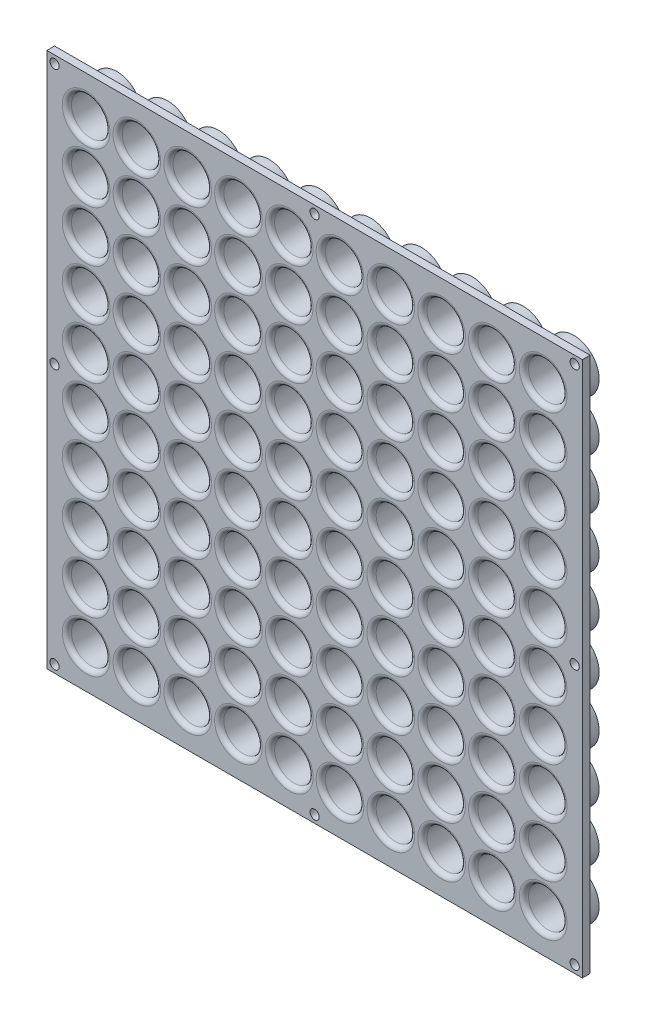
from build123d import *

# Parameters (mm, degrees)
SKETCH1_W                       = 250
SKETCH1_H                       = 250
BOSS_EXTRUDE1_DEPTH             = 50
SKETCH2_W                       = 40
SKETCH2_H                       = 100
SKETCH2_H_2                     = 50
CUT_EXTRUDE1_DEPTH              = 45
FILLET1_R                       = 5
FILLET2_R                       = 5
SKETCH5_R                       = 6.25
CUT_EXTRUDE2_DEPTH              = 22
FILLET5_R                       = 1.5
LPATTERN4_COUNT                 = 10
LPATTERN4_PITCH                 = 16.5
LPATTERN4_COUNT_DIR2            = 10
LPATTERN4_PITCH_DIR2            = 16.5
FILLET5_OF_LPATTERN4_R          = 1.5
CUT_EXTRUDE4_DEPTH              = 45
SKETCH8_W                       = 100
SKETCH8_H                       = 20
CUT_EXTRUDE5_DEPTH              = 30
FILLET6_R                       = 2.5
FILLET7_R                       = 2
SKETCH10_R                      = 13.5
CUT_EXTRUDE6_DEPTH              = 358.071421427
SKETCH4_W                       = 25
SKETCH4_H                       = 17.5
CUT_EXTRUDE7_DEPTH              = 10
VERRUNDUNG1_R                   = 2.5
SKIZZE2_W                       = 25
SKIZZE2_H                       = 5
AUFSATZ_LINEAR_AUSTRAGEN1_DEPTH = 12.5
AUFSATZ_LINEAR_AUSTRAGEN2_DEPTH = 10
SCHNITT_LINEAR_START            = -10
SCHNITT_LINEAR_AUSTRAGEN3_DEPTH = 230
SCHNITT_LINEAR_AUSTRAGEN4_DEPTH = 25
SCHNITT_LINEAR_AUSTRAGEN5_DEPTH = 10
SKIZZE11_W                      = 250
SKIZZE11_H                      = 250
SKIZZE11_W_2                    = 174
SKIZZE11_H_2                    = 174
SCHNITT_LINEAR_AUSTRAGEN6_DEPTH = 358.071421441
SKIZZE12_R                      = 8.2
SKIZZE12_R_2                    = 6.25
AUFSATZ_LINEAR_AUSTRAGEN3_DEPTH = 5
SKIZZE14_R                      = 1.5
SCHNITT_LINEAR_AUSTRAGEN7_DEPTH = 5
SKIZZE15_W                      = 174
SKIZZE15_H                      = 174
SKIZZE15_W_2                    = 164.9
SKIZZE15_H_2                    = 164.9
SCHNITT_LINEAR_AUSTRAGEN8_DEPTH = 2.5
VERRUNDUNG3_R                   = 2.5


with BuildPart() as part:
    # Sketch1 → Boss-Extrude1 (new body)
    with BuildSketch(Plane.XY):
        with Locations((-125, 125)):
            Rectangle(SKETCH1_W, SKETCH1_H)
    extrude(amount=BOSS_EXTRUDE1_DEPTH)

    # Sketch2 → Cut-Extrude1 (cut)
    with BuildSketch(Plane.XY.offset(50)):
        with Locations((-35, 170)):
            Rectangle(SKETCH2_W, SKETCH2_H)
        with Locations((-35, 70)):
            Rectangle(SKETCH2_W, SKETCH2_H_2)
    extrude(amount=-CUT_EXTRUDE1_DEPTH, mode=Mode.SUBTRACT)

    # Fillet1
    fillet1_edges = [part.edges().sort_by_distance(p)[0] for p in [
        (-55, 170, 50),
        (-35, 120, 50),
        (-15, 170, 50),
        (-35, 220, 50),
    ]]
    fillet(fillet1_edges, radius=FILLET1_R)

    # Fillet2
    fillet2_edges = [part.edges().sort_by_distance(p)[0] for p in [
        (-55, 70, 50),
        (-35, 45, 50),
        (-15, 70, 50),
        (-35, 95, 50),
    ]]
    fillet(fillet2_edges, radius=FILLET2_R)

    # Sketch5 → Cut-Extrude2 (cut)
    with BuildSketch(Plane.XY.offset(50)):
        with Locations((-225, 190)):
            Circle(SKETCH5_R)
    cut_extrude2 = extrude(amount=-CUT_EXTRUDE2_DEPTH, mode=Mode.SUBTRACT)

    # Fillet5
    fillet5_edges = [part.edges().sort_by_distance(p)[0] for p in [
        (-231.25, 190, 50),
    ]]
    fillet(fillet5_edges, radius=FILLET5_R)

    # LPattern4: Cut-Extrude2 10 × 10
    with Locations(*[(i * LPATTERN4_PITCH, -j * LPATTERN4_PITCH_DIR2, 0) for i in range(LPATTERN4_COUNT) for j in range(LPATTERN4_COUNT_DIR2) if (i, j) != (0, 0)]):
        add(cut_extrude2, mode=Mode.SUBTRACT)

    # Fillet5 of LPattern4
    fillet5_of_lpattern4_edges = [part.edges().sort_by_distance(p)[0] for p in [
        (-231.25, 173.5, 50),
        (-231.25, 157, 50),
        (-231.25, 140.5, 50),
        (-231.25, 124, 50),
        (-231.25, 107.5, 50),
        (-231.25, 91, 50),
        (-231.25, 74.5, 50),
        (-231.25, 58, 50),
        (-231.25, 41.5, 50),
        (-214.75, 190, 50),
        (-214.75, 173.5, 50),
        (-214.75, 157, 50),
        (-214.75, 140.5, 50),
        (-214.75, 124, 50),
        (-214.75, 107.5, 50),
        (-214.75, 91, 50),
        (-214.75, 74.5, 50),
        (-214.75, 58, 50),
        (-214.75, 41.5, 50),
        (-198.25, 190, 50),
        (-198.25, 173.5, 50),
        (-198.25, 157, 50),
        (-198.25, 140.5, 50),
        (-198.25, 124, 50),
        (-198.25, 107.5, 50),
        (-198.25, 91, 50),
        (-198.25, 74.5, 50),
        (-198.25, 58, 50),
        (-198.25, 41.5, 50),
        (-181.75, 190, 50),
        (-181.75, 173.5, 50),
        (-181.75, 157, 50),
        (-181.75, 140.5, 50),
        (-181.75, 124, 50),
        (-181.75, 107.5, 50),
        (-181.75, 91, 50),
        (-181.75, 74.5, 50),
        (-181.75, 58, 50),
        (-181.75, 41.5, 50),
        (-165.25, 190, 50),
        (-165.25, 173.5, 50),
        (-165.25, 157, 50),
        (-165.25, 140.5, 50),
        (-165.25, 124, 50),
        (-165.25, 107.5, 50),
        (-165.25, 91, 50),
        (-165.25, 74.5, 50),
        (-165.25, 58, 50),
        (-165.25, 41.5, 50),
        (-148.75, 190, 50),
        (-148.75, 173.5, 50),
        (-148.75, 157, 50),
        (-148.75, 140.5, 50),
        (-148.75, 124, 50),
        (-148.75, 107.5, 50),
        (-148.75, 91, 50),
        (-148.75, 74.5, 50),
        (-148.75, 58, 50),
        (-148.75, 41.5, 50),
        (-132.25, 190, 50),
        (-132.25, 173.5, 50),
        (-132.25, 157, 50),
        (-132.25, 140.5, 50),
        (-132.25, 124, 50),
        (-132.25, 107.5, 50),
        (-132.25, 91, 50),
        (-132.25, 74.5, 50),
        (-132.25, 58, 50),
        (-132.25, 41.5, 50),
        (-115.75, 190, 50),
        (-115.75, 173.5, 50),
        (-115.75, 157, 50),
        (-115.75, 140.5, 50),
        (-115.75, 124, 50),
        (-115.75, 107.5, 50),
        (-115.75, 91, 50),
        (-115.75, 74.5, 50),
        (-115.75, 58, 50),
        (-115.75, 41.5, 50),
        (-99.25, 190, 50),
        (-99.25, 173.5, 50),
        (-99.25, 157, 50),
        (-99.25, 140.5, 50),
        (-99.25, 124, 50),
        (-99.25, 107.5, 50),
        (-99.25, 91, 50),
        (-99.25, 74.5, 50),
        (-99.25, 58, 50),
        (-99.25, 41.5, 50),
        (-82.75, 190, 50),
        (-82.75, 173.5, 50),
        (-82.75, 157, 50),
        (-82.75, 140.5, 50),
        (-82.75, 124, 50),
        (-82.75, 107.5, 50),
        (-82.75, 91, 50),
        (-82.75, 74.5, 50),
        (-82.75, 58, 50),
        (-82.75, 41.5, 50),
    ]]
    fillet(fillet5_of_lpattern4_edges, radius=FILLET5_OF_LPATTERN4_R)

    # Sketch7 → Cut-Extrude4 (cut)
    with BuildSketch(Plane(origin=(0, 0, 0), x_dir=(-1, 0, 0), z_dir=(0, 0, -1))):
        Polygon((5, 245), (245, 245), (245, 5), (5, 5), (5, 40), (60, 40), (60, 100), (5, 100), (5, 115), (60, 115), (60, 225), (5, 225), align=None)
    extrude(amount=-CUT_EXTRUDE4_DEPTH, mode=Mode.SUBTRACT)

    # Sketch8 → Cut-Extrude5 (cut)
    with BuildSketch(Plane.XY.offset(50)):
        with Locations((-125, 240)):
            Rectangle(SKETCH8_W, SKETCH8_H)
    extrude(amount=-CUT_EXTRUDE5_DEPTH, mode=Mode.SUBTRACT)

    # Fillet6
    fillet6_edges = [part.edges().sort_by_distance(p)[0] for p in [
        (-125, 230, 45),
        (-125, 230, 50),
    ]]
    fillet(fillet6_edges, radius=FILLET6_R - 0.0001)  # a hair under: the kernel refuses the full size

    # Fillet7
    fillet7_edges = [part.edges().sort_by_distance(p)[0] for p in [
        (-125, 245, 20),
        (-125, 250, 20),
    ]]
    fillet(fillet7_edges, radius=FILLET7_R)

    # Sketch10 → Cut-Extrude6 (cut, through all)
    with BuildSketch(Plane.XY.offset(50)):
        with Locations((-35, 20)):
            Circle(SKETCH10_R)
    extrude(amount=-CUT_EXTRUDE6_DEPTH, mode=Mode.SUBTRACT)

    # Sketch4 → Cut-Extrude7 (cut)
    with BuildSketch(Plane.XY.offset(50)):
        with Locations((-187.5, 241.25)):
            Rectangle(SKETCH4_W, SKETCH4_H)
        with Locations((-62.5, 241.25)):
            Rectangle(SKETCH4_W, SKETCH4_H)
    extrude(amount=-CUT_EXTRUDE7_DEPTH, mode=Mode.SUBTRACT)

    # Verrundung1
    verrundung1_edges = [part.edges().sort_by_distance(p)[0] for p in [
        (-48.5, 20, 45),
        (-48.5, 20, 50),
    ]]
    fillet(verrundung1_edges, radius=VERRUNDUNG1_R - 0.0001)  # a hair under: the kernel refuses the full size

    # Skizze2 → Aufsatz-Linear austragen1 (add)
    with BuildSketch(Plane.XZ.offset(-245)):
        with Locations((-187.5, 37.5)):
            Rectangle(SKIZZE2_W, SKIZZE2_H)
        with Locations((-62.5, 37.5)):
            Rectangle(SKIZZE2_W, SKIZZE2_H)
    extrude(amount=AUFSATZ_LINEAR_AUSTRAGEN1_DEPTH)

    # Skizze4 → Aufsatz-Linear austragen2 (add)
    with BuildSketch(Plane(origin=(0, 0, 45), x_dir=(-1, 0, 0), z_dir=(0, 0, -1))):
        Polygon((50, 232.5), (75, 232.5), (75, 227.5), (49, 227.5), (49, 245), (50, 245), align=None)
        Polygon((200, 232.5), (175, 232.5), (175, 227.5), (201, 227.5), (201, 245), (200, 245), align=None)
    extrude(amount=AUFSATZ_LINEAR_AUSTRAGEN2_DEPTH)

    # Skizze8 → Schnitt-Linear austragen3 (cut)
    with BuildSketch(Plane.XZ.offset(SCHNITT_LINEAR_START)):
        Polygon((-245, 7), (-248, 7), (-248, 4.7), (-246, 4.7), (-245, 4.4), align=None)
    extrude(amount=-SCHNITT_LINEAR_AUSTRAGEN3_DEPTH, mode=Mode.SUBTRACT)

    # Skizze9 → Schnitt-Linear austragen4 (cut)
    with BuildSketch(Plane.XZ.offset(SCHNITT_LINEAR_START)):
        Polygon((-3.733974596, 5), (-4.6, 6.5), (-6.332050808, 6.5), (-7.198076211, 5), (-6.332050808, 3.5), (-4.6, 3.5), align=None)
    extrude(amount=-SCHNITT_LINEAR_AUSTRAGEN4_DEPTH, mode=Mode.SUBTRACT)

    # Skizze10 → Schnitt-Linear austragen5 (cut)
    with BuildSketch(Plane(origin=(0, 250, 0), x_dir=(1, 0, 0), z_dir=(0, 1, 0)).offset(SCHNITT_LINEAR_START)):
        Polygon((-4.6, -3.5), (-6.332050808, -3.5), (-7.198076211, -5), (-6.332050808, -6.5), (-4.6, -6.5), (-3.733974596, -5), align=None)
    extrude(amount=-SCHNITT_LINEAR_AUSTRAGEN5_DEPTH, mode=Mode.SUBTRACT)

    # Skizze11 → Schnitt-Linear austragen6 (cut, through all)
    with BuildSketch(Plane.XY.offset(50)):
        with Locations((-125, 125)):
            Rectangle(SKIZZE11_W, SKIZZE11_H)
        with Locations((-150.75, 115.75)):
            Rectangle(SKIZZE11_W_2, SKIZZE11_H_2, mode=Mode.SUBTRACT)
    extrude(amount=-SCHNITT_LINEAR_AUSTRAGEN6_DEPTH, mode=Mode.SUBTRACT)

    # Skizze12 → Aufsatz-Linear austragen3 (add)
    # profile 1 of 100: a face of its own
    with BuildSketch(Plane(origin=(0, 0, 45), x_dir=(-1, 0, 0), z_dir=(0, 0, -1))):
        with Locations((76.5, 190)):
            Circle(SKIZZE12_R)
        with Locations(Location((76.5, 190, 0), (0, 0, 180))):
            Circle(SKIZZE12_R_2, mode=Mode.SUBTRACT)
    # profile 2 of 100: a face of its own
    with BuildSketch(Plane(origin=(0, 0, 45), x_dir=(-1, 0, 0), z_dir=(0, 0, -1))):
        with Locations((93, 190)):
            Circle(SKIZZE12_R)
        with Locations(Location((93, 190, 0), (0, 0, 180))):
            Circle(SKIZZE12_R_2, mode=Mode.SUBTRACT)
    # profile 3 of 100: a face of its own
    with BuildSketch(Plane(origin=(0, 0, 45), x_dir=(-1, 0, 0), z_dir=(0, 0, -1))):
        with Locations((109.5, 190)):
            Circle(SKIZZE12_R)
        with Locations(Location((109.5, 190, 0), (0, 0, 180))):
            Circle(SKIZZE12_R_2, mode=Mode.SUBTRACT)
    # profile 4 of 100: a face of its own
    with BuildSketch(Plane(origin=(0, 0, 45), x_dir=(-1, 0, 0), z_dir=(0, 0, -1))):
        with Locations((126, 190)):
            Circle(SKIZZE12_R)
        with Locations(Location((126, 190, 0), (0, 0, 180))):
            Circle(SKIZZE12_R_2, mode=Mode.SUBTRACT)
    # profile 5 of 100: a face of its own
    with BuildSketch(Plane(origin=(0, 0, 45), x_dir=(-1, 0, 0), z_dir=(0, 0, -1))):
        with Locations((142.5, 190)):
            Circle(SKIZZE12_R)
        with Locations(Location((142.5, 190, 0), (0, 0, 180))):
            Circle(SKIZZE12_R_2, mode=Mode.SUBTRACT)
    # profile 6 of 100: a face of its own
    with BuildSketch(Plane(origin=(0, 0, 45), x_dir=(-1, 0, 0), z_dir=(0, 0, -1))):
        with Locations((159, 190)):
            Circle(SKIZZE12_R)
        with Locations(Location((159, 190, 0), (0, 0, 180))):
            Circle(SKIZZE12_R_2, mode=Mode.SUBTRACT)
    # profile 7 of 100: a face of its own
    with BuildSketch(Plane(origin=(0, 0, 45), x_dir=(-1, 0, 0), z_dir=(0, 0, -1))):
        with Locations((175.5, 190)):
            Circle(SKIZZE12_R)
        with Locations(Location((175.5, 190, 0), (0, 0, 180))):
            Circle(SKIZZE12_R_2, mode=Mode.SUBTRACT)
    # profile 8 of 100: a face of its own
    with BuildSketch(Plane(origin=(0, 0, 45), x_dir=(-1, 0, 0), z_dir=(0, 0, -1))):
        with Locations((192, 190)):
            Circle(SKIZZE12_R)
        with Locations(Location((192, 190, 0), (0, 0, 180))):
            Circle(SKIZZE12_R_2, mode=Mode.SUBTRACT)
    # profile 9 of 100: a face of its own
    with BuildSketch(Plane(origin=(0, 0, 45), x_dir=(-1, 0, 0), z_dir=(0, 0, -1))):
        with Locations((208.5, 190)):
            Circle(SKIZZE12_R)
        with Locations(Location((208.5, 190, 0), (0, 0, 180))):
            Circle(SKIZZE12_R_2, mode=Mode.SUBTRACT)
    # profile 10 of 100: a face of its own
    with BuildSketch(Plane(origin=(0, 0, 45), x_dir=(-1, 0, 0), z_dir=(0, 0, -1))):
        with Locations((225, 190)):
            Circle(SKIZZE12_R)
        with Locations(Location((225, 190, 0), (0, 0, 180))):
            Circle(SKIZZE12_R_2, mode=Mode.SUBTRACT)
    # profile 11 of 100: a face of its own
    with BuildSketch(Plane(origin=(0, 0, 45), x_dir=(-1, 0, 0), z_dir=(0, 0, -1))):
        with Locations((93, 173.5)):
            Circle(SKIZZE12_R)
        with Locations(Location((93, 173.5, 0), (0, 0, 180))):
            Circle(SKIZZE12_R_2, mode=Mode.SUBTRACT)
    # profile 12 of 100: a face of its own
    with BuildSketch(Plane(origin=(0, 0, 45), x_dir=(-1, 0, 0), z_dir=(0, 0, -1))):
        with Locations((109.5, 173.5)):
            Circle(SKIZZE12_R)
        with Locations(Location((109.5, 173.5, 0), (0, 0, 180))):
            Circle(SKIZZE12_R_2, mode=Mode.SUBTRACT)
    # profile 13 of 100: a face of its own
    with BuildSketch(Plane(origin=(0, 0, 45), x_dir=(-1, 0, 0), z_dir=(0, 0, -1))):
        with Locations((126, 173.5)):
            Circle(SKIZZE12_R)
        with Locations(Location((126, 173.5, 0), (0, 0, 180))):
            Circle(SKIZZE12_R_2, mode=Mode.SUBTRACT)
    # profile 14 of 100: a face of its own
    with BuildSketch(Plane(origin=(0, 0, 45), x_dir=(-1, 0, 0), z_dir=(0, 0, -1))):
        with Locations((142.5, 173.5)):
            Circle(SKIZZE12_R)
        with Locations(Location((142.5, 173.5, 0), (0, 0, 180))):
            Circle(SKIZZE12_R_2, mode=Mode.SUBTRACT)
    # profile 15 of 100: a face of its own
    with BuildSketch(Plane(origin=(0, 0, 45), x_dir=(-1, 0, 0), z_dir=(0, 0, -1))):
        with Locations((159, 173.5)):
            Circle(SKIZZE12_R)
        with Locations(Location((159, 173.5, 0), (0, 0, 180))):
            Circle(SKIZZE12_R_2, mode=Mode.SUBTRACT)
    # profile 16 of 100: a face of its own
    with BuildSketch(Plane(origin=(0, 0, 45), x_dir=(-1, 0, 0), z_dir=(0, 0, -1))):
        with Locations((175.5, 173.5)):
            Circle(SKIZZE12_R)
        with Locations(Location((175.5, 173.5, 0), (0, 0, 180))):
            Circle(SKIZZE12_R_2, mode=Mode.SUBTRACT)
    # profile 17 of 100: a face of its own
    with BuildSketch(Plane(origin=(0, 0, 45), x_dir=(-1, 0, 0), z_dir=(0, 0, -1))):
        with Locations((192, 173.5)):
            Circle(SKIZZE12_R)
        with Locations(Location((192, 173.5, 0), (0, 0, 180))):
            Circle(SKIZZE12_R_2, mode=Mode.SUBTRACT)
    # profile 18 of 100: a face of its own
    with BuildSketch(Plane(origin=(0, 0, 45), x_dir=(-1, 0, 0), z_dir=(0, 0, -1))):
        with Locations((208.5, 173.5)):
            Circle(SKIZZE12_R)
        with Locations(Location((208.5, 173.5, 0), (0, 0, 180))):
            Circle(SKIZZE12_R_2, mode=Mode.SUBTRACT)
    # profile 19 of 100: a face of its own
    with BuildSketch(Plane(origin=(0, 0, 45), x_dir=(-1, 0, 0), z_dir=(0, 0, -1))):
        with Locations((225, 173.5)):
            Circle(SKIZZE12_R)
        with Locations(Location((225, 173.5, 0), (0, 0, 180))):
            Circle(SKIZZE12_R_2, mode=Mode.SUBTRACT)
    # profile 20 of 100: a face of its own
    with BuildSketch(Plane(origin=(0, 0, 45), x_dir=(-1, 0, 0), z_dir=(0, 0, -1))):
        with Locations((93, 157)):
            Circle(SKIZZE12_R)
        with Locations(Location((93, 157, 0), (0, 0, 180))):
            Circle(SKIZZE12_R_2, mode=Mode.SUBTRACT)
    # profile 21 of 100: a face of its own
    with BuildSketch(Plane(origin=(0, 0, 45), x_dir=(-1, 0, 0), z_dir=(0, 0, -1))):
        with Locations((109.5, 157)):
            Circle(SKIZZE12_R)
        with Locations(Location((109.5, 157, 0), (0, 0, 180))):
            Circle(SKIZZE12_R_2, mode=Mode.SUBTRACT)
    # profile 22 of 100: a face of its own
    with BuildSketch(Plane(origin=(0, 0, 45), x_dir=(-1, 0, 0), z_dir=(0, 0, -1))):
        with Locations((126, 157)):
            Circle(SKIZZE12_R)
        with Locations(Location((126, 157, 0), (0, 0, 180))):
            Circle(SKIZZE12_R_2, mode=Mode.SUBTRACT)
    # profile 23 of 100: a face of its own
    with BuildSketch(Plane(origin=(0, 0, 45), x_dir=(-1, 0, 0), z_dir=(0, 0, -1))):
        with Locations((142.5, 157)):
            Circle(SKIZZE12_R)
        with Locations(Location((142.5, 157, 0), (0, 0, 180))):
            Circle(SKIZZE12_R_2, mode=Mode.SUBTRACT)
    # profile 24 of 100: a face of its own
    with BuildSketch(Plane(origin=(0, 0, 45), x_dir=(-1, 0, 0), z_dir=(0, 0, -1))):
        with Locations((159, 157)):
            Circle(SKIZZE12_R)
        with Locations(Location((159, 157, 0), (0, 0, 180))):
            Circle(SKIZZE12_R_2, mode=Mode.SUBTRACT)
    # profile 25 of 100: a face of its own
    with BuildSketch(Plane(origin=(0, 0, 45), x_dir=(-1, 0, 0), z_dir=(0, 0, -1))):
        with Locations((175.5, 157)):
            Circle(SKIZZE12_R)
        with Locations(Location((175.5, 157, 0), (0, 0, 180))):
            Circle(SKIZZE12_R_2, mode=Mode.SUBTRACT)
    # profile 26 of 100: a face of its own
    with BuildSketch(Plane(origin=(0, 0, 45), x_dir=(-1, 0, 0), z_dir=(0, 0, -1))):
        with Locations((192, 157)):
            Circle(SKIZZE12_R)
        with Locations(Location((192, 157, 0), (0, 0, 180))):
            Circle(SKIZZE12_R_2, mode=Mode.SUBTRACT)
    # profile 27 of 100: a face of its own
    with BuildSketch(Plane(origin=(0, 0, 45), x_dir=(-1, 0, 0), z_dir=(0, 0, -1))):
        with Locations((208.5, 157)):
            Circle(SKIZZE12_R)
        with Locations(Location((208.5, 157, 0), (0, 0, 180))):
            Circle(SKIZZE12_R_2, mode=Mode.SUBTRACT)
    # profile 28 of 100: a face of its own
    with BuildSketch(Plane(origin=(0, 0, 45), x_dir=(-1, 0, 0), z_dir=(0, 0, -1))):
        with Locations((225, 157)):
            Circle(SKIZZE12_R)
        with Locations(Location((225, 157, 0), (0, 0, 180))):
            Circle(SKIZZE12_R_2, mode=Mode.SUBTRACT)
    # profile 29 of 100: a face of its own
    with BuildSketch(Plane(origin=(0, 0, 45), x_dir=(-1, 0, 0), z_dir=(0, 0, -1))):
        with Locations((93, 140.5)):
            Circle(SKIZZE12_R)
        with Locations(Location((93, 140.5, 0), (0, 0, 180))):
            Circle(SKIZZE12_R_2, mode=Mode.SUBTRACT)
    # profile 30 of 100: a face of its own
    with BuildSketch(Plane(origin=(0, 0, 45), x_dir=(-1, 0, 0), z_dir=(0, 0, -1))):
        with Locations((109.5, 140.5)):
            Circle(SKIZZE12_R)
        with Locations(Location((109.5, 140.5, 0), (0, 0, 180))):
            Circle(SKIZZE12_R_2, mode=Mode.SUBTRACT)
    # profile 31 of 100: a face of its own
    with BuildSketch(Plane(origin=(0, 0, 45), x_dir=(-1, 0, 0), z_dir=(0, 0, -1))):
        with Locations((126, 140.5)):
            Circle(SKIZZE12_R)
        with Locations(Location((126, 140.5, 0), (0, 0, 180))):
            Circle(SKIZZE12_R_2, mode=Mode.SUBTRACT)
    # profile 32 of 100: a face of its own
    with BuildSketch(Plane(origin=(0, 0, 45), x_dir=(-1, 0, 0), z_dir=(0, 0, -1))):
        with Locations((142.5, 140.5)):
            Circle(SKIZZE12_R)
        with Locations(Location((142.5, 140.5, 0), (0, 0, 180))):
            Circle(SKIZZE12_R_2, mode=Mode.SUBTRACT)
    # profile 33 of 100: a face of its own
    with BuildSketch(Plane(origin=(0, 0, 45), x_dir=(-1, 0, 0), z_dir=(0, 0, -1))):
        with Locations((159, 140.5)):
            Circle(SKIZZE12_R)
        with Locations(Location((159, 140.5, 0), (0, 0, 180))):
            Circle(SKIZZE12_R_2, mode=Mode.SUBTRACT)
    # profile 34 of 100: a face of its own
    with BuildSketch(Plane(origin=(0, 0, 45), x_dir=(-1, 0, 0), z_dir=(0, 0, -1))):
        with Locations((175.5, 140.5)):
            Circle(SKIZZE12_R)
        with Locations(Location((175.5, 140.5, 0), (0, 0, 180))):
            Circle(SKIZZE12_R_2, mode=Mode.SUBTRACT)
    # profile 35 of 100: a face of its own
    with BuildSketch(Plane(origin=(0, 0, 45), x_dir=(-1, 0, 0), z_dir=(0, 0, -1))):
        with Locations((192, 140.5)):
            Circle(SKIZZE12_R)
        with Locations(Location((192, 140.5, 0), (0, 0, 180))):
            Circle(SKIZZE12_R_2, mode=Mode.SUBTRACT)
    # profile 36 of 100: a face of its own
    with BuildSketch(Plane(origin=(0, 0, 45), x_dir=(-1, 0, 0), z_dir=(0, 0, -1))):
        with Locations((208.5, 140.5)):
            Circle(SKIZZE12_R)
        with Locations(Location((208.5, 140.5, 0), (0, 0, 180))):
            Circle(SKIZZE12_R_2, mode=Mode.SUBTRACT)
    # profile 37 of 100: a face of its own
    with BuildSketch(Plane(origin=(0, 0, 45), x_dir=(-1, 0, 0), z_dir=(0, 0, -1))):
        with Locations((225, 140.5)):
            Circle(SKIZZE12_R)
        with Locations(Location((225, 140.5, 0), (0, 0, 180))):
            Circle(SKIZZE12_R_2, mode=Mode.SUBTRACT)
    # profile 38 of 100: a face of its own
    with BuildSketch(Plane(origin=(0, 0, 45), x_dir=(-1, 0, 0), z_dir=(0, 0, -1))):
        with Locations((93, 124)):
            Circle(SKIZZE12_R)
        with Locations(Location((93, 124, 0), (0, 0, 180))):
            Circle(SKIZZE12_R_2, mode=Mode.SUBTRACT)
    # profile 39 of 100: a face of its own
    with BuildSketch(Plane(origin=(0, 0, 45), x_dir=(-1, 0, 0), z_dir=(0, 0, -1))):
        with Locations((109.5, 124)):
            Circle(SKIZZE12_R)
        with Locations(Location((109.5, 124, 0), (0, 0, 180))):
            Circle(SKIZZE12_R_2, mode=Mode.SUBTRACT)
    # profile 40 of 100: a face of its own
    with BuildSketch(Plane(origin=(0, 0, 45), x_dir=(-1, 0, 0), z_dir=(0, 0, -1))):
        with Locations((126, 124)):
            Circle(SKIZZE12_R)
        with Locations(Location((126, 124, 0), (0, 0, 180))):
            Circle(SKIZZE12_R_2, mode=Mode.SUBTRACT)
    # profile 41 of 100: a face of its own
    with BuildSketch(Plane(origin=(0, 0, 45), x_dir=(-1, 0, 0), z_dir=(0, 0, -1))):
        with Locations((142.5, 124)):
            Circle(SKIZZE12_R)
        with Locations(Location((142.5, 124, 0), (0, 0, 180))):
            Circle(SKIZZE12_R_2, mode=Mode.SUBTRACT)
    # profile 42 of 100: a face of its own
    with BuildSketch(Plane(origin=(0, 0, 45), x_dir=(-1, 0, 0), z_dir=(0, 0, -1))):
        with Locations((159, 124)):
            Circle(SKIZZE12_R)
        with Locations(Location((159, 124, 0), (0, 0, 180))):
            Circle(SKIZZE12_R_2, mode=Mode.SUBTRACT)
    # profile 43 of 100: a face of its own
    with BuildSketch(Plane(origin=(0, 0, 45), x_dir=(-1, 0, 0), z_dir=(0, 0, -1))):
        with Locations((175.5, 124)):
            Circle(SKIZZE12_R)
        with Locations(Location((175.5, 124, 0), (0, 0, 180))):
            Circle(SKIZZE12_R_2, mode=Mode.SUBTRACT)
    # profile 44 of 100: a face of its own
    with BuildSketch(Plane(origin=(0, 0, 45), x_dir=(-1, 0, 0), z_dir=(0, 0, -1))):
        with Locations((192, 124)):
            Circle(SKIZZE12_R)
        with Locations(Location((192, 124, 0), (0, 0, 180))):
            Circle(SKIZZE12_R_2, mode=Mode.SUBTRACT)
    # profile 45 of 100: a face of its own
    with BuildSketch(Plane(origin=(0, 0, 45), x_dir=(-1, 0, 0), z_dir=(0, 0, -1))):
        with Locations((208.5, 124)):
            Circle(SKIZZE12_R)
        with Locations(Location((208.5, 124, 0), (0, 0, 180))):
            Circle(SKIZZE12_R_2, mode=Mode.SUBTRACT)
    # profile 46 of 100: a face of its own
    with BuildSketch(Plane(origin=(0, 0, 45), x_dir=(-1, 0, 0), z_dir=(0, 0, -1))):
        with Locations((225, 124)):
            Circle(SKIZZE12_R)
        with Locations(Location((225, 124, 0), (0, 0, 180))):
            Circle(SKIZZE12_R_2, mode=Mode.SUBTRACT)
    # profile 47 of 100: a face of its own
    with BuildSketch(Plane(origin=(0, 0, 45), x_dir=(-1, 0, 0), z_dir=(0, 0, -1))):
        with Locations((93, 107.5)):
            Circle(SKIZZE12_R)
        with Locations(Location((93, 107.5, 0), (0, 0, 180))):
            Circle(SKIZZE12_R_2, mode=Mode.SUBTRACT)
    # profile 48 of 100: a face of its own
    with BuildSketch(Plane(origin=(0, 0, 45), x_dir=(-1, 0, 0), z_dir=(0, 0, -1))):
        with Locations((109.5, 107.5)):
            Circle(SKIZZE12_R)
        with Locations(Location((109.5, 107.5, 0), (0, 0, 180))):
            Circle(SKIZZE12_R_2, mode=Mode.SUBTRACT)
    # profile 49 of 100: a face of its own
    with BuildSketch(Plane(origin=(0, 0, 45), x_dir=(-1, 0, 0), z_dir=(0, 0, -1))):
        with Locations((126, 107.5)):
            Circle(SKIZZE12_R)
        with Locations(Location((126, 107.5, 0), (0, 0, 180))):
            Circle(SKIZZE12_R_2, mode=Mode.SUBTRACT)
    # profile 50 of 100: a face of its own
    with BuildSketch(Plane(origin=(0, 0, 45), x_dir=(-1, 0, 0), z_dir=(0, 0, -1))):
        with Locations((142.5, 107.5)):
            Circle(SKIZZE12_R)
        with Locations(Location((142.5, 107.5, 0), (0, 0, 180))):
            Circle(SKIZZE12_R_2, mode=Mode.SUBTRACT)
    # profile 51 of 100: a face of its own
    with BuildSketch(Plane(origin=(0, 0, 45), x_dir=(-1, 0, 0), z_dir=(0, 0, -1))):
        with Locations((159, 107.5)):
            Circle(SKIZZE12_R)
        with Locations(Location((159, 107.5, 0), (0, 0, 180))):
            Circle(SKIZZE12_R_2, mode=Mode.SUBTRACT)
    # profile 52 of 100: a face of its own
    with BuildSketch(Plane(origin=(0, 0, 45), x_dir=(-1, 0, 0), z_dir=(0, 0, -1))):
        with Locations((175.5, 107.5)):
            Circle(SKIZZE12_R)
        with Locations(Location((175.5, 107.5, 0), (0, 0, 180))):
            Circle(SKIZZE12_R_2, mode=Mode.SUBTRACT)
    # profile 53 of 100: a face of its own
    with BuildSketch(Plane(origin=(0, 0, 45), x_dir=(-1, 0, 0), z_dir=(0, 0, -1))):
        with Locations((192, 107.5)):
            Circle(SKIZZE12_R)
        with Locations(Location((192, 107.5, 0), (0, 0, 180))):
            Circle(SKIZZE12_R_2, mode=Mode.SUBTRACT)
    # profile 54 of 100: a face of its own
    with BuildSketch(Plane(origin=(0, 0, 45), x_dir=(-1, 0, 0), z_dir=(0, 0, -1))):
        with Locations((208.5, 107.5)):
            Circle(SKIZZE12_R)
        with Locations(Location((208.5, 107.5, 0), (0, 0, 180))):
            Circle(SKIZZE12_R_2, mode=Mode.SUBTRACT)
    # profile 55 of 100: a face of its own
    with BuildSketch(Plane(origin=(0, 0, 45), x_dir=(-1, 0, 0), z_dir=(0, 0, -1))):
        with Locations((225, 107.5)):
            Circle(SKIZZE12_R)
        with Locations(Location((225, 107.5, 0), (0, 0, 180))):
            Circle(SKIZZE12_R_2, mode=Mode.SUBTRACT)
    # profile 56 of 100: a face of its own
    with BuildSketch(Plane(origin=(0, 0, 45), x_dir=(-1, 0, 0), z_dir=(0, 0, -1))):
        with Locations((93, 91)):
            Circle(SKIZZE12_R)
        with Locations(Location((93, 91, 0), (0, 0, 180))):
            Circle(SKIZZE12_R_2, mode=Mode.SUBTRACT)
    # profile 57 of 100: a face of its own
    with BuildSketch(Plane(origin=(0, 0, 45), x_dir=(-1, 0, 0), z_dir=(0, 0, -1))):
        with Locations((109.5, 91)):
            Circle(SKIZZE12_R)
        with Locations(Location((109.5, 91, 0), (0, 0, 180))):
            Circle(SKIZZE12_R_2, mode=Mode.SUBTRACT)
    # profile 58 of 100: a face of its own
    with BuildSketch(Plane(origin=(0, 0, 45), x_dir=(-1, 0, 0), z_dir=(0, 0, -1))):
        with Locations((126, 91)):
            Circle(SKIZZE12_R)
        with Locations(Location((126, 91, 0), (0, 0, 180))):
            Circle(SKIZZE12_R_2, mode=Mode.SUBTRACT)
    # profile 59 of 100: a face of its own
    with BuildSketch(Plane(origin=(0, 0, 45), x_dir=(-1, 0, 0), z_dir=(0, 0, -1))):
        with Locations((142.5, 91)):
            Circle(SKIZZE12_R)
        with Locations(Location((142.5, 91, 0), (0, 0, 180))):
            Circle(SKIZZE12_R_2, mode=Mode.SUBTRACT)
    # profile 60 of 100: a face of its own
    with BuildSketch(Plane(origin=(0, 0, 45), x_dir=(-1, 0, 0), z_dir=(0, 0, -1))):
        with Locations((159, 91)):
            Circle(SKIZZE12_R)
        with Locations(Location((159, 91, 0), (0, 0, 180))):
            Circle(SKIZZE12_R_2, mode=Mode.SUBTRACT)
    # profile 61 of 100: a face of its own
    with BuildSketch(Plane(origin=(0, 0, 45), x_dir=(-1, 0, 0), z_dir=(0, 0, -1))):
        with Locations((175.5, 91)):
            Circle(SKIZZE12_R)
        with Locations(Location((175.5, 91, 0), (0, 0, 180))):
            Circle(SKIZZE12_R_2, mode=Mode.SUBTRACT)
    # profile 62 of 100: a face of its own
    with BuildSketch(Plane(origin=(0, 0, 45), x_dir=(-1, 0, 0), z_dir=(0, 0, -1))):
        with Locations((192, 91)):
            Circle(SKIZZE12_R)
        with Locations(Location((192, 91, 0), (0, 0, 180))):
            Circle(SKIZZE12_R_2, mode=Mode.SUBTRACT)
    # profile 63 of 100: a face of its own
    with BuildSketch(Plane(origin=(0, 0, 45), x_dir=(-1, 0, 0), z_dir=(0, 0, -1))):
        with Locations((208.5, 91)):
            Circle(SKIZZE12_R)
        with Locations(Location((208.5, 91, 0), (0, 0, 180))):
            Circle(SKIZZE12_R_2, mode=Mode.SUBTRACT)
    # profile 64 of 100: a face of its own
    with BuildSketch(Plane(origin=(0, 0, 45), x_dir=(-1, 0, 0), z_dir=(0, 0, -1))):
        with Locations((225, 91)):
            Circle(SKIZZE12_R)
        with Locations(Location((225, 91, 0), (0, 0, 180))):
            Circle(SKIZZE12_R_2, mode=Mode.SUBTRACT)
    # profile 65 of 100: a face of its own
    with BuildSketch(Plane(origin=(0, 0, 45), x_dir=(-1, 0, 0), z_dir=(0, 0, -1))):
        with Locations((93, 74.5)):
            Circle(SKIZZE12_R)
        with Locations(Location((93, 74.5, 0), (0, 0, 180))):
            Circle(SKIZZE12_R_2, mode=Mode.SUBTRACT)
    # profile 66 of 100: a face of its own
    with BuildSketch(Plane(origin=(0, 0, 45), x_dir=(-1, 0, 0), z_dir=(0, 0, -1))):
        with Locations((109.5, 74.5)):
            Circle(SKIZZE12_R)
        with Locations(Location((109.5, 74.5, 0), (0, 0, 180))):
            Circle(SKIZZE12_R_2, mode=Mode.SUBTRACT)
    # profile 67 of 100: a face of its own
    with BuildSketch(Plane(origin=(0, 0, 45), x_dir=(-1, 0, 0), z_dir=(0, 0, -1))):
        with Locations((126, 74.5)):
            Circle(SKIZZE12_R)
        with Locations(Location((126, 74.5, 0), (0, 0, 180))):
            Circle(SKIZZE12_R_2, mode=Mode.SUBTRACT)
    # profile 68 of 100: a face of its own
    with BuildSketch(Plane(origin=(0, 0, 45), x_dir=(-1, 0, 0), z_dir=(0, 0, -1))):
        with Locations((142.5, 74.5)):
            Circle(SKIZZE12_R)
        with Locations(Location((142.5, 74.5, 0), (0, 0, 180))):
            Circle(SKIZZE12_R_2, mode=Mode.SUBTRACT)
    # profile 69 of 100: a face of its own
    with BuildSketch(Plane(origin=(0, 0, 45), x_dir=(-1, 0, 0), z_dir=(0, 0, -1))):
        with Locations((159, 74.5)):
            Circle(SKIZZE12_R)
        with Locations(Location((159, 74.5, 0), (0, 0, 180))):
            Circle(SKIZZE12_R_2, mode=Mode.SUBTRACT)
    # profile 70 of 100: a face of its own
    with BuildSketch(Plane(origin=(0, 0, 45), x_dir=(-1, 0, 0), z_dir=(0, 0, -1))):
        with Locations((175.5, 74.5)):
            Circle(SKIZZE12_R)
        with Locations(Location((175.5, 74.5, 0), (0, 0, 180))):
            Circle(SKIZZE12_R_2, mode=Mode.SUBTRACT)
    # profile 71 of 100: a face of its own
    with BuildSketch(Plane(origin=(0, 0, 45), x_dir=(-1, 0, 0), z_dir=(0, 0, -1))):
        with Locations((192, 74.5)):
            Circle(SKIZZE12_R)
        with Locations(Location((192, 74.5, 0), (0, 0, 180))):
            Circle(SKIZZE12_R_2, mode=Mode.SUBTRACT)
    # profile 72 of 100: a face of its own
    with BuildSketch(Plane(origin=(0, 0, 45), x_dir=(-1, 0, 0), z_dir=(0, 0, -1))):
        with Locations((208.5, 74.5)):
            Circle(SKIZZE12_R)
        with Locations(Location((208.5, 74.5, 0), (0, 0, 180))):
            Circle(SKIZZE12_R_2, mode=Mode.SUBTRACT)
    # profile 73 of 100: a face of its own
    with BuildSketch(Plane(origin=(0, 0, 45), x_dir=(-1, 0, 0), z_dir=(0, 0, -1))):
        with Locations((225, 74.5)):
            Circle(SKIZZE12_R)
        with Locations(Location((225, 74.5, 0), (0, 0, 180))):
            Circle(SKIZZE12_R_2, mode=Mode.SUBTRACT)
    # profile 74 of 100: a face of its own
    with BuildSketch(Plane(origin=(0, 0, 45), x_dir=(-1, 0, 0), z_dir=(0, 0, -1))):
        with Locations((93, 58)):
            Circle(SKIZZE12_R)
        with Locations(Location((93, 58, 0), (0, 0, 180))):
            Circle(SKIZZE12_R_2, mode=Mode.SUBTRACT)
    # profile 75 of 100: a face of its own
    with BuildSketch(Plane(origin=(0, 0, 45), x_dir=(-1, 0, 0), z_dir=(0, 0, -1))):
        with Locations((109.5, 58)):
            Circle(SKIZZE12_R)
        with Locations(Location((109.5, 58, 0), (0, 0, 180))):
            Circle(SKIZZE12_R_2, mode=Mode.SUBTRACT)
    # profile 76 of 100: a face of its own
    with BuildSketch(Plane(origin=(0, 0, 45), x_dir=(-1, 0, 0), z_dir=(0, 0, -1))):
        with Locations((126, 58)):
            Circle(SKIZZE12_R)
        with Locations(Location((126, 58, 0), (0, 0, 180))):
            Circle(SKIZZE12_R_2, mode=Mode.SUBTRACT)
    # profile 77 of 100: a face of its own
    with BuildSketch(Plane(origin=(0, 0, 45), x_dir=(-1, 0, 0), z_dir=(0, 0, -1))):
        with Locations((142.5, 58)):
            Circle(SKIZZE12_R)
        with Locations(Location((142.5, 58, 0), (0, 0, 180))):
            Circle(SKIZZE12_R_2, mode=Mode.SUBTRACT)
    # profile 78 of 100: a face of its own
    with BuildSketch(Plane(origin=(0, 0, 45), x_dir=(-1, 0, 0), z_dir=(0, 0, -1))):
        with Locations((159, 58)):
            Circle(SKIZZE12_R)
        with Locations(Location((159, 58, 0), (0, 0, 180))):
            Circle(SKIZZE12_R_2, mode=Mode.SUBTRACT)
    # profile 79 of 100: a face of its own
    with BuildSketch(Plane(origin=(0, 0, 45), x_dir=(-1, 0, 0), z_dir=(0, 0, -1))):
        with Locations((175.5, 58)):
            Circle(SKIZZE12_R)
        with Locations(Location((175.5, 58, 0), (0, 0, 180))):
            Circle(SKIZZE12_R_2, mode=Mode.SUBTRACT)
    # profile 80 of 100: a face of its own
    with BuildSketch(Plane(origin=(0, 0, 45), x_dir=(-1, 0, 0), z_dir=(0, 0, -1))):
        with Locations((192, 58)):
            Circle(SKIZZE12_R)
        with Locations(Location((192, 58, 0), (0, 0, 180))):
            Circle(SKIZZE12_R_2, mode=Mode.SUBTRACT)
    # profile 81 of 100: a face of its own
    with BuildSketch(Plane(origin=(0, 0, 45), x_dir=(-1, 0, 0), z_dir=(0, 0, -1))):
        with Locations((208.5, 58)):
            Circle(SKIZZE12_R)
        with Locations(Location((208.5, 58, 0), (0, 0, 180))):
            Circle(SKIZZE12_R_2, mode=Mode.SUBTRACT)
    # profile 82 of 100: a face of its own
    with BuildSketch(Plane(origin=(0, 0, 45), x_dir=(-1, 0, 0), z_dir=(0, 0, -1))):
        with Locations((225, 58)):
            Circle(SKIZZE12_R)
        with Locations(Location((225, 58, 0), (0, 0, 180))):
            Circle(SKIZZE12_R_2, mode=Mode.SUBTRACT)
    # profile 83 of 100: a face of its own
    with BuildSketch(Plane(origin=(0, 0, 45), x_dir=(-1, 0, 0), z_dir=(0, 0, -1))):
        with Locations((93, 41.5)):
            Circle(SKIZZE12_R)
        with Locations(Location((93, 41.5, 0), (0, 0, 180))):
            Circle(SKIZZE12_R_2, mode=Mode.SUBTRACT)
    # profile 84 of 100: a face of its own
    with BuildSketch(Plane(origin=(0, 0, 45), x_dir=(-1, 0, 0), z_dir=(0, 0, -1))):
        with Locations((109.5, 41.5)):
            Circle(SKIZZE12_R)
        with Locations(Location((109.5, 41.5, 0), (0, 0, 180))):
            Circle(SKIZZE12_R_2, mode=Mode.SUBTRACT)
    # profile 85 of 100: a face of its own
    with BuildSketch(Plane(origin=(0, 0, 45), x_dir=(-1, 0, 0), z_dir=(0, 0, -1))):
        with Locations((126, 41.5)):
            Circle(SKIZZE12_R)
        with Locations(Location((126, 41.5, 0), (0, 0, 180))):
            Circle(SKIZZE12_R_2, mode=Mode.SUBTRACT)
    # profile 86 of 100: a face of its own
    with BuildSketch(Plane(origin=(0, 0, 45), x_dir=(-1, 0, 0), z_dir=(0, 0, -1))):
        with Locations((142.5, 41.5)):
            Circle(SKIZZE12_R)
        with Locations(Location((142.5, 41.5, 0), (0, 0, 180))):
            Circle(SKIZZE12_R_2, mode=Mode.SUBTRACT)
    # profile 87 of 100: a face of its own
    with BuildSketch(Plane(origin=(0, 0, 45), x_dir=(-1, 0, 0), z_dir=(0, 0, -1))):
        with Locations((159, 41.5)):
            Circle(SKIZZE12_R)
        with Locations(Location((159, 41.5, 0), (0, 0, 180))):
            Circle(SKIZZE12_R_2, mode=Mode.SUBTRACT)
    # profile 88 of 100: a face of its own
    with BuildSketch(Plane(origin=(0, 0, 45), x_dir=(-1, 0, 0), z_dir=(0, 0, -1))):
        with Locations((175.5, 41.5)):
            Circle(SKIZZE12_R)
        with Locations(Location((175.5, 41.5, 0), (0, 0, 180))):
            Circle(SKIZZE12_R_2, mode=Mode.SUBTRACT)
    # profile 89 of 100: a face of its own
    with BuildSketch(Plane(origin=(0, 0, 45), x_dir=(-1, 0, 0), z_dir=(0, 0, -1))):
        with Locations((192, 41.5)):
            Circle(SKIZZE12_R)
        with Locations(Location((192, 41.5, 0), (0, 0, 180))):
            Circle(SKIZZE12_R_2, mode=Mode.SUBTRACT)
    # profile 90 of 100: a face of its own
    with BuildSketch(Plane(origin=(0, 0, 45), x_dir=(-1, 0, 0), z_dir=(0, 0, -1))):
        with Locations((208.5, 41.5)):
            Circle(SKIZZE12_R)
        with Locations(Location((208.5, 41.5, 0), (0, 0, 180))):
            Circle(SKIZZE12_R_2, mode=Mode.SUBTRACT)
    # profile 91 of 100: a face of its own
    with BuildSketch(Plane(origin=(0, 0, 45), x_dir=(-1, 0, 0), z_dir=(0, 0, -1))):
        with Locations((225, 41.5)):
            Circle(SKIZZE12_R)
        with Locations(Location((225, 41.5, 0), (0, 0, 180))):
            Circle(SKIZZE12_R_2, mode=Mode.SUBTRACT)
    # profile 92 of 100: a face of its own
    with BuildSketch(Plane(origin=(0, 0, 45), x_dir=(-1, 0, 0), z_dir=(0, 0, -1))):
        with Locations((76.5, 173.5)):
            Circle(SKIZZE12_R)
        with Locations(Location((76.5, 173.5, 0), (0, 0, 180))):
            Circle(SKIZZE12_R_2, mode=Mode.SUBTRACT)
    # profile 93 of 100: a face of its own
    with BuildSketch(Plane(origin=(0, 0, 45), x_dir=(-1, 0, 0), z_dir=(0, 0, -1))):
        with Locations((76.5, 157)):
            Circle(SKIZZE12_R)
        with Locations(Location((76.5, 157, 0), (0, 0, 180))):
            Circle(SKIZZE12_R_2, mode=Mode.SUBTRACT)
    # profile 94 of 100: a face of its own
    with BuildSketch(Plane(origin=(0, 0, 45), x_dir=(-1, 0, 0), z_dir=(0, 0, -1))):
        with Locations((76.5, 140.5)):
            Circle(SKIZZE12_R)
        with Locations(Location((76.5, 140.5, 0), (0, 0, 180))):
            Circle(SKIZZE12_R_2, mode=Mode.SUBTRACT)
    # profile 95 of 100: a face of its own
    with BuildSketch(Plane(origin=(0, 0, 45), x_dir=(-1, 0, 0), z_dir=(0, 0, -1))):
        with Locations((76.5, 124)):
            Circle(SKIZZE12_R)
        with Locations(Location((76.5, 124, 0), (0, 0, 180))):
            Circle(SKIZZE12_R_2, mode=Mode.SUBTRACT)
    # profile 96 of 100: a face of its own
    with BuildSketch(Plane(origin=(0, 0, 45), x_dir=(-1, 0, 0), z_dir=(0, 0, -1))):
        with Locations((76.5, 107.5)):
            Circle(SKIZZE12_R)
        with Locations(Location((76.5, 107.5, 0), (0, 0, 180))):
            Circle(SKIZZE12_R_2, mode=Mode.SUBTRACT)
    # profile 97 of 100: a face of its own
    with BuildSketch(Plane(origin=(0, 0, 45), x_dir=(-1, 0, 0), z_dir=(0, 0, -1))):
        with Locations((76.5, 91)):
            Circle(SKIZZE12_R)
        with Locations(Location((76.5, 91, 0), (0, 0, 180))):
            Circle(SKIZZE12_R_2, mode=Mode.SUBTRACT)
    # profile 98 of 100: a face of its own
    with BuildSketch(Plane(origin=(0, 0, 45), x_dir=(-1, 0, 0), z_dir=(0, 0, -1))):
        with Locations((76.5, 74.5)):
            Circle(SKIZZE12_R)
        with Locations(Location((76.5, 74.5, 0), (0, 0, 180))):
            Circle(SKIZZE12_R_2, mode=Mode.SUBTRACT)
    # profile 99 of 100: a face of its own
    with BuildSketch(Plane(origin=(0, 0, 45), x_dir=(-1, 0, 0), z_dir=(0, 0, -1))):
        with Locations((76.5, 58)):
            Circle(SKIZZE12_R)
        with Locations(Location((76.5, 58, 0), (0, 0, 180))):
            Circle(SKIZZE12_R_2, mode=Mode.SUBTRACT)
    # profile 100 of 100: a face of its own
    with BuildSketch(Plane(origin=(0, 0, 45), x_dir=(-1, 0, 0), z_dir=(0, 0, -1))):
        with Locations((76.5, 41.5)):
            Circle(SKIZZE12_R)
        with Locations(Location((76.5, 41.5, 0), (0, 0, 180))):
            Circle(SKIZZE12_R_2, mode=Mode.SUBTRACT)
    extrude(amount=AUFSATZ_LINEAR_AUSTRAGEN3_DEPTH)

    # Skizze14 → Schnitt-Linear austragen7 (cut)
    with BuildSketch(Plane.XY.offset(50)):
        with Locations((-235.25, 200.25)):
            Circle(SKIZZE14_R)
        with Locations((-150.75, 200.25)):
            Circle(SKIZZE14_R)
        with Locations((-66.25, 200.25)):
            Circle(SKIZZE14_R)
        with Locations((-235.25, 115.75)):
            Circle(SKIZZE14_R)
        with Locations((-66.25, 115.75)):
            Circle(SKIZZE14_R)
        with Locations(Location((-66.25, 31.25, 0), (0, 0, 180))):
            Circle(SKIZZE14_R)
        with Locations(Location((-150.75, 31.25, 0), (0, 0, 180))):
            Circle(SKIZZE14_R)
        with Locations(Location((-235.25, 31.25, 0), (0, 0, 180))):
            Circle(SKIZZE14_R)
    extrude(amount=-SCHNITT_LINEAR_AUSTRAGEN7_DEPTH, mode=Mode.SUBTRACT)

    # Skizze15 → Schnitt-Linear austragen8 (cut)
    with BuildSketch(Plane(origin=(0, 0, 45), x_dir=(-1, 0, 0), z_dir=(0, 0, -1))):
        with Locations((150.75, 115.75)):
            Rectangle(SKIZZE15_W, SKIZZE15_H)
        with Locations((150.75, 115.75)):
            Rectangle(SKIZZE15_W_2, SKIZZE15_H_2, mode=Mode.SUBTRACT)
    extrude(amount=-SCHNITT_LINEAR_AUSTRAGEN8_DEPTH, mode=Mode.SUBTRACT)

    # Verrundung3
    verrundung3_edges = [part.edges().sort_by_distance(p)[0] for p in [
        (-68.3, 198.2, 46.25),
        (-233.2, 198.2, 46.25),
        (-233.2, 33.3, 46.25),
        (-68.3, 33.3, 46.25),
    ]]
    fillet(verrundung3_edges, radius=VERRUNDUNG3_R)


solid = part.part
